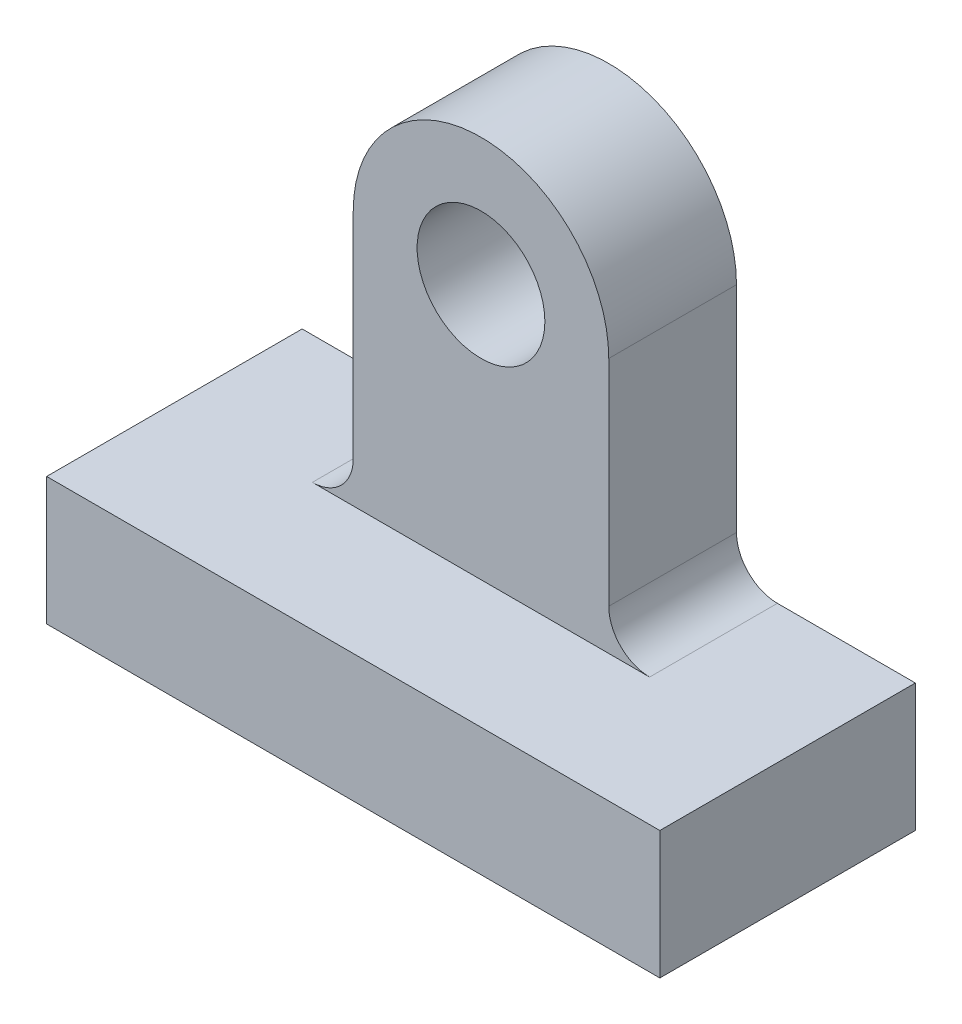
from build123d import *

# Parameters (mm, degrees)
SKETCH1_W           = 120
SKETCH1_H           = 50
BOSS_EXTRUDE3_DEPTH = 25
SKETCH2_W           = 50
SKETCH2_H           = 25
BOSS_EXTRUDE4_DEPTH = 75
SKETCH3_R           = 12.5
CUT_EXTRUDE2_DEPTH  = 120.268604419
FILLET1_R           = 8


with BuildPart() as part:
    # Sketch1 → Boss-Extrude3 (new body)
    with BuildSketch(Plane(origin=(0, 0, 0), x_dir=(1, 0, 0), z_dir=(0, 1, 0))):
        Rectangle(SKETCH1_W, SKETCH1_H)
    extrude(amount=BOSS_EXTRUDE3_DEPTH)

    # Sketch2 → Boss-Extrude4 (add)
    with BuildSketch(Plane(origin=(0, 25, 0), x_dir=(1, 0, 0), z_dir=(0, 1, 0))):
        with Locations((0, 12.5)):
            Rectangle(SKETCH2_W, SKETCH2_H)
    extrude(amount=BOSS_EXTRUDE4_DEPTH)

    # Sketch3 → Cut-Extrude2 (cut, through all)
    with BuildSketch(Plane.XY):
        with Locations((0, 75)):
            Circle(SKETCH3_R)
        with BuildLine():
            ThreePointArc((-25, 75), (-17.67766953, 92.67766953), (0, 100))
            Line((0, 100), (-25, 100))
            Line((-25, 100), (-25, 75))
        make_face()
        with BuildLine():
            Line((25, 100), (0, 100))
            ThreePointArc((0, 100), (17.67766953, 92.67766953), (25, 75))
            Line((25, 75), (25, 100))
        make_face()
    extrude(amount=-CUT_EXTRUDE2_DEPTH, mode=Mode.SUBTRACT)

    # Fillet1
    fillet1_edges = [part.edges().sort_by_distance(p)[0] for p in [
        (-25, 25, -12.5),
        (25, 25, -12.5),
    ]]
    fillet(fillet1_edges, radius=FILLET1_R)


solid = part.part
